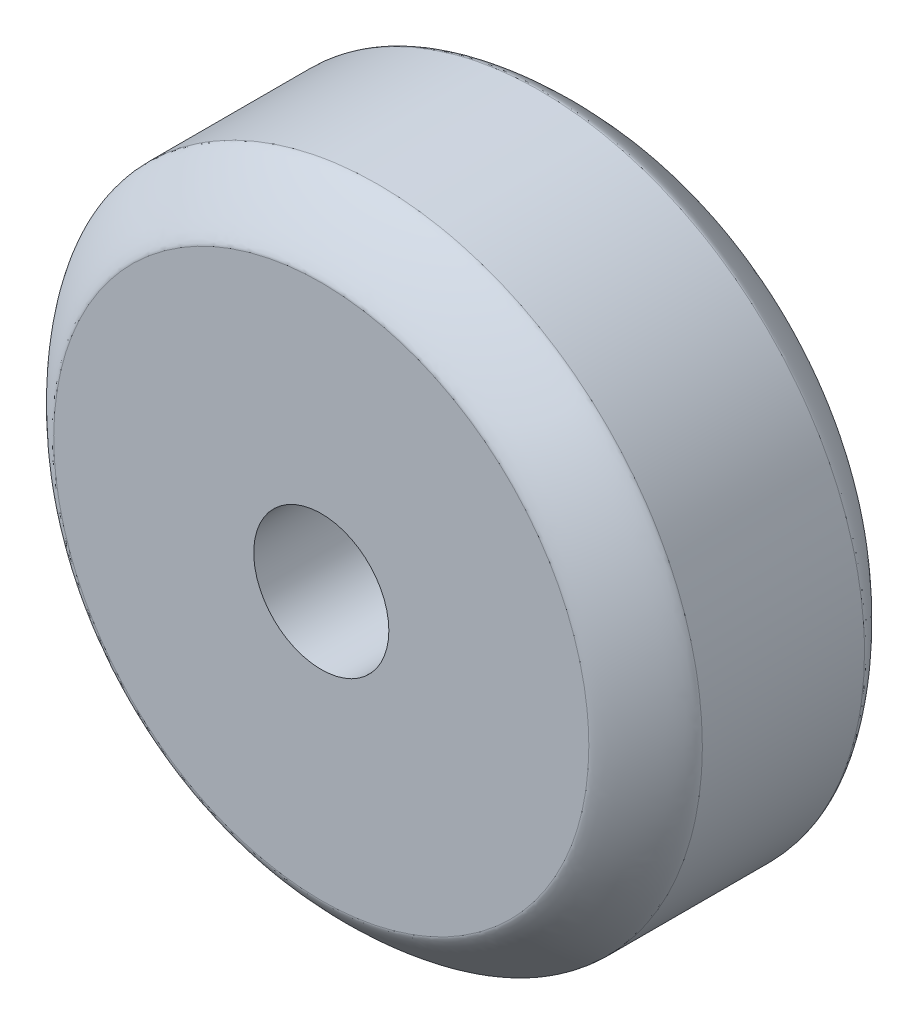
from build123d import *

# Parameters (mm, degrees)
SKETCH1_R           = 12
SKETCH1_R_2         = 2.5
BOSS_EXTRUDE1_DEPTH = 10.2
FILLET1_SIZE        = 2.1


with BuildPart() as part:
    # Sketch1 → Boss-Extrude1 (new body)
    with BuildSketch(Plane.XY):
        Circle(SKETCH1_R)
        Circle(SKETCH1_R_2, mode=Mode.SUBTRACT)
    extrude(amount=BOSS_EXTRUDE1_DEPTH)

    # Fillet1
    # a fillet whose section is not a circle: 2.1 mm, written as the material it takes off along each edge
    with BuildSketch(Plane(origin=(0, 0, 0), x_dir=(1, 0, 0), z_dir=(0, -1, 0))) as fillet1_piece_1:
        with BuildLine():
            Bezier((12, FILLET1_SIZE), (12, 0), (12 - FILLET1_SIZE, 0), weights=[1, 0.148492424, 1])
            Line((12 - FILLET1_SIZE, 0), (12, 0))
            Line((12, 0), (12, FILLET1_SIZE))
        make_face()
    revolve(axis=Axis((0, 0, 0), (0, 0, 1)), mode=Mode.SUBTRACT)
    with BuildSketch(Plane(origin=(0, 0, 10.2), x_dir=(1, 0, 0), z_dir=(0, -1, 0))) as fillet1_piece_2:
        with BuildLine():
            Bezier((12, -FILLET1_SIZE), (12, 0), (12 - FILLET1_SIZE, 0), weights=[1, 0.148492424, 1])
            Line((12 - FILLET1_SIZE, 0), (12, 0))
            Line((12, 0), (12, -FILLET1_SIZE))
        make_face()
    revolve(axis=Axis((0, 0, 10.2), (0, 0, 1)), mode=Mode.SUBTRACT)


solid = part.part
